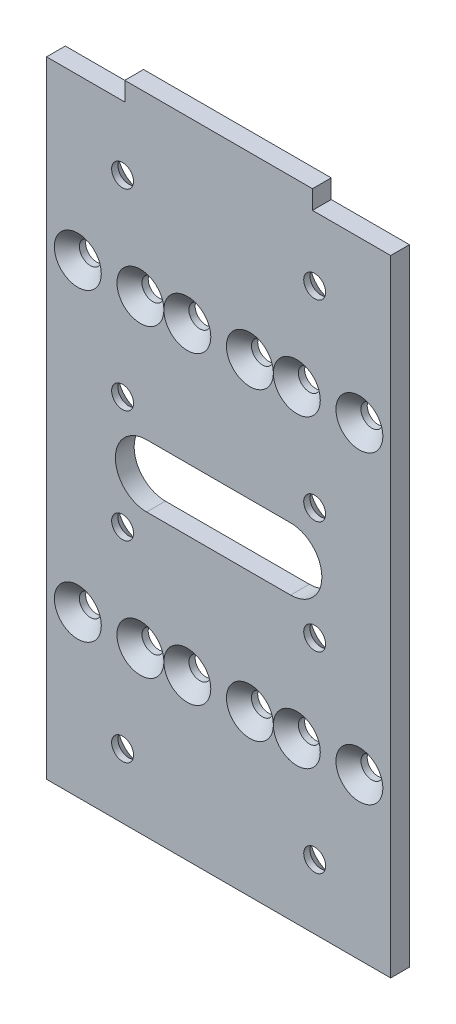
from build123d import *

# Parameters (mm, degrees)
SKETCH_1_W          = 30
SKETCH_1_H          = 3
EXTRUDE_1_DEPTH     = 3
SKETCH_2_R          = 1.75
CUT_EXTRUDE_1_DEPTH = 10
SKETCH_3_R          = 1.75
CUT_EXTRUDE_2_DEPTH = 10
CHAMFER_1_SIZE      = 2
CHAMFER_2_SIZE      = 2
CUT_EXTRUDE_3_DEPTH = 3


with BuildPart() as part:
    # Эскиз1 → Бобышка-Вытянуть1 (new body)
    with BuildSketch(Plane.XY):
        Polygon((-27.5, 50), (-27.5, -50), (27.5, -50), (27.5, 50), (15, 50), (15, 47), (-15, 47), (-15, 50), align=None)
        with Locations((0, 48.5)):
            Rectangle(SKETCH_1_W, SKETCH_1_H)
        with Locations((0, 51.5)):
            Rectangle(SKETCH_1_W, SKETCH_1_H)
    extrude(amount=EXTRUDE_1_DEPTH)

    # Эскиз2 → Вырез-Вытянуть1 (cut)
    with BuildSketch(Plane.XY.offset(3)):
        with Locations((-15.35, 39.7)):
            Circle(SKETCH_2_R)
        with Locations((15.35, 39.7)):
            Circle(SKETCH_2_R)
        with Locations((15.35, 9)):
            Circle(SKETCH_2_R)
        with Locations((-15.35, 9)):
            Circle(SKETCH_2_R)
        with Locations((-15.35, -9)):
            Circle(SKETCH_2_R)
        with Locations((15.35, -9)):
            Circle(SKETCH_2_R)
        with Locations((15.35, -39.7)):
            Circle(SKETCH_2_R)
        with Locations((-15.35, -39.7)):
            Circle(SKETCH_2_R)
    extrude(amount=-CUT_EXTRUDE_1_DEPTH, mode=Mode.SUBTRACT)

    # Эскиз3 → Вырез-Вытянуть2 (cut)
    with BuildSketch(Plane(origin=(0, 0, 0), x_dir=(-1, 0, 0), z_dir=(0, 0, -1))):
        with Locations((-22.5, 24.35)):
            Circle(SKETCH_3_R)
        with Locations((-12.5, 24.35)):
            Circle(SKETCH_3_R)
        with Locations((-5, 24.35)):
            Circle(SKETCH_3_R)
        with Locations((5, 24.35)):
            Circle(SKETCH_3_R)
        with Locations((12.5, 24.35)):
            Circle(SKETCH_3_R)
        with Locations((22.5, 24.35)):
            Circle(SKETCH_3_R)
        with Locations(Location((22.5, -24.35, 0), (0, 0, 180))):
            Circle(SKETCH_3_R)
        with Locations(Location((12.5, -24.35, 0), (0, 0, 180))):
            Circle(SKETCH_3_R)
        with Locations(Location((5, -24.35, 0), (0, 0, 180))):
            Circle(SKETCH_3_R)
        with Locations(Location((-5, -24.35, 0), (0, 0, 180))):
            Circle(SKETCH_3_R)
        with Locations(Location((-12.5, -24.35, 0), (0, 0, 180))):
            Circle(SKETCH_3_R)
        with Locations(Location((-22.5, -24.35, 0), (0, 0, 180))):
            Circle(SKETCH_3_R)
    extrude(amount=-CUT_EXTRUDE_2_DEPTH, mode=Mode.SUBTRACT)

    # Фаска1
    chamfer_1_edges = [part.edges().sort_by_distance(p)[0] for p in [
        (-17.1, -9, 0),
        (-17.1, 9, 0),
        (13.6, 9, 0),
        (-17.1, 39.7, 0),
        (13.6, -9, 0),
        (13.6, -39.7, 0),
        (-17.1, -39.7, 0),
        (13.6, 39.7, 0),
    ]]
    chamfer(chamfer_1_edges, length=CHAMFER_1_SIZE)

    # Фаска2
    chamfer_2_edges = [part.edges().sort_by_distance(p)[0] for p in [
        (14.25, 24.35, 3),
        (3.25, -24.35, 3),
        (10.75, -24.35, 3),
        (20.75, -24.35, 3),
        (24.25, 24.35, 3),
        (-6.75, -24.35, 3),
        (-14.25, -24.35, 3),
        (-24.25, -24.35, 3),
        (-20.75, 24.35, 3),
        (-10.75, 24.35, 3),
        (-3.25, 24.35, 3),
        (6.75, 24.35, 3),
    ]]
    chamfer(chamfer_2_edges, length=CHAMFER_2_SIZE - 0.0001)  # a hair under: the kernel refuses the full size

    # Эскиз4 → Вырез-Вытянуть3 (cut)
    with BuildSketch(Plane(origin=(0, 0, 0), x_dir=(-1, 0, 0), z_dir=(0, 0, -1))):
        with BuildLine():
            Line((-11.5, 5), (11.5, 5))
            ThreePointArc((11.5, 5), (16.5, 0), (11.5, -5))
            Line((11.5, -5), (-11.5, -5))
            ThreePointArc((-11.5, -5), (-16.5, 0), (-11.5, 5))
        make_face()
    extrude(amount=-CUT_EXTRUDE_3_DEPTH, mode=Mode.SUBTRACT)


solid = part.part
